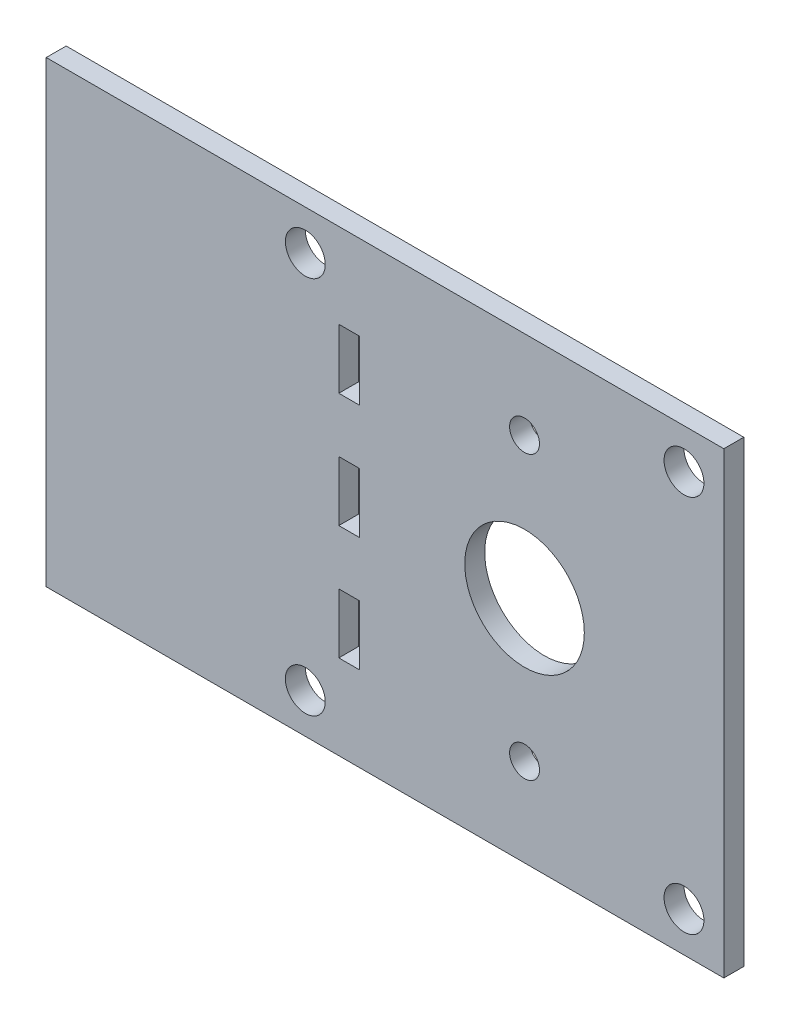
from build123d import *

# Parameters (mm, degrees)
SKETCH1_W           = 215.9
SKETCH1_H           = 146.05
SKETCH1_R           = 6.35
SKETCH1_R_2         = 19.05
SKETCH1_R_3         = 4.7625
SKETCH1_W_2         = 6.604
SKETCH1_H_2         = 19.05
BOSS_EXTRUDE1_DEPTH = 3.175


with BuildPart() as part:
    # Sketch1 → Boss-Extrude1 (new, symmetric)
    with BuildSketch(Plane.XY):
        with Locations((-44.45, 0)):
            Rectangle(SKETCH1_W, SKETCH1_H)
        with Locations((50.8, 60.325)):
            Circle(SKETCH1_R, mode=Mode.SUBTRACT)
        with Locations((50.8, -60.325)):
            Circle(SKETCH1_R, mode=Mode.SUBTRACT)
        Circle(SKETCH1_R_2, mode=Mode.SUBTRACT)
        with Locations((0, 45)):
            Circle(SKETCH1_R_3, mode=Mode.SUBTRACT)
        with Locations((0, -45)):
            Circle(SKETCH1_R_3, mode=Mode.SUBTRACT)
        with Locations((-69.85, 60.325)):
            Circle(SKETCH1_R, mode=Mode.SUBTRACT)
        with Locations((-69.85, -60.325)):
            Circle(SKETCH1_R, mode=Mode.SUBTRACT)
        with Locations((-55.88, 0)):
            Rectangle(SKETCH1_W_2, SKETCH1_H_2, mode=Mode.SUBTRACT)
        with Locations((-55.88, 36.5125)):
            Rectangle(SKETCH1_W_2, SKETCH1_H_2, mode=Mode.SUBTRACT)
        with Locations((-55.88, -36.5125)):
            Rectangle(SKETCH1_W_2, SKETCH1_H_2, mode=Mode.SUBTRACT)
    extrude(amount=BOSS_EXTRUDE1_DEPTH, both=True)


solid = part.part
